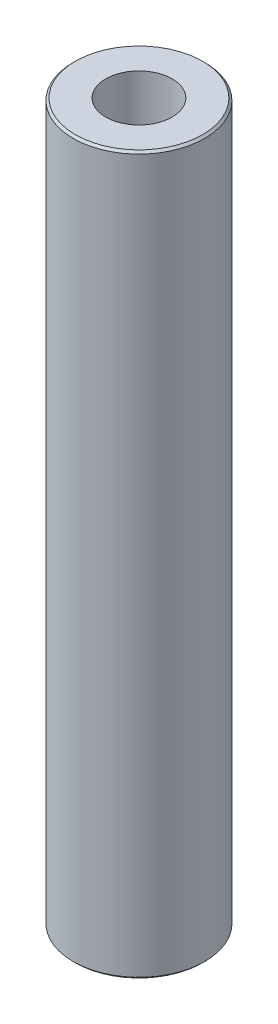
from build123d import *

# Parameters (mm, degrees)
SKETCH1_R           = 42.5
BOSS_EXTRUDE1_DEPTH = 463.289840388
SKETCH2_R           = 21.434386418
CUT_EXTRUDE1_DEPTH  = 468.172319606
CHAMFER1_SIZE       = 1.398314527


with BuildPart() as part:
    # Sketch1 → Boss-Extrude1 (new body)
    with BuildSketch(Plane(origin=(0, 0, 0), x_dir=(1, 0, 0), z_dir=(0, 1, 0))):
        Circle(SKETCH1_R)
    extrude(amount=BOSS_EXTRUDE1_DEPTH)

    # Sketch2 → Cut-Extrude1 (cut, through all)
    with BuildSketch(Plane(origin=(0, 0, 0), x_dir=(1, 0, 0), z_dir=(0, 1, 0))):
        Circle(SKETCH2_R)
    extrude(amount=CUT_EXTRUDE1_DEPTH, mode=Mode.SUBTRACT)

    # Chamfer1
    chamfer1_edges = [part.edges().sort_by_distance(p)[0] for p in [
        (-42.5, 463.289840388, 0),
        (-42.5, 0, 0),
    ]]
    chamfer(chamfer1_edges, length=CHAMFER1_SIZE)


solid = part.part
